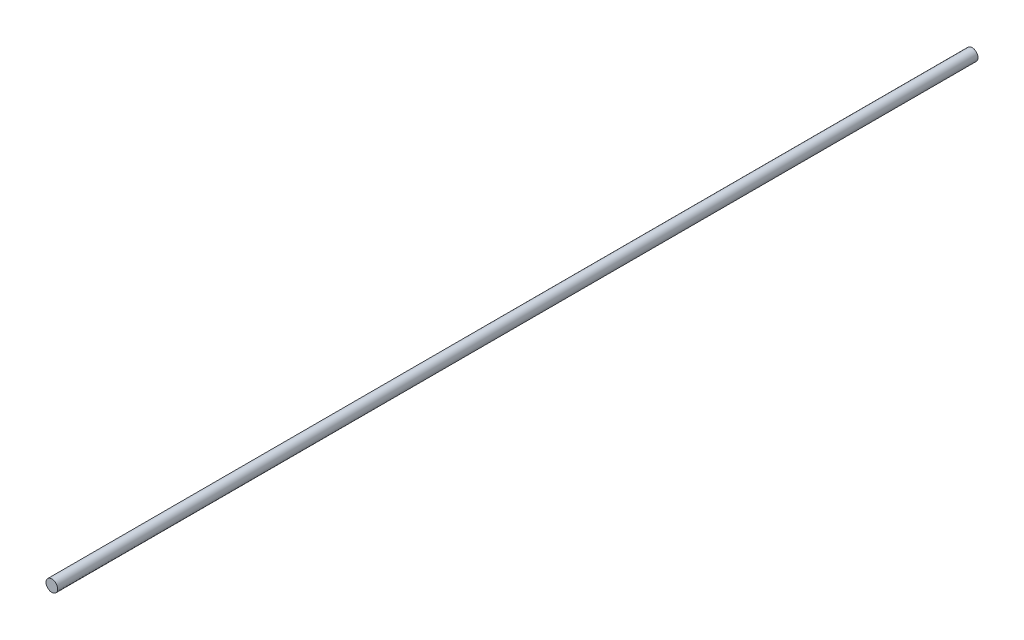
from build123d import *

# Parameters (mm, degrees)
SKETCH1_R           = 0.975
BOSS_EXTRUDE1_DEPTH = 153.75


with BuildPart() as part:
    # Sketch1 → Boss-Extrude1 (new body)
    with BuildSketch(Plane.XY):
        Circle(SKETCH1_R)
    extrude(amount=BOSS_EXTRUDE1_DEPTH)


solid = part.part
